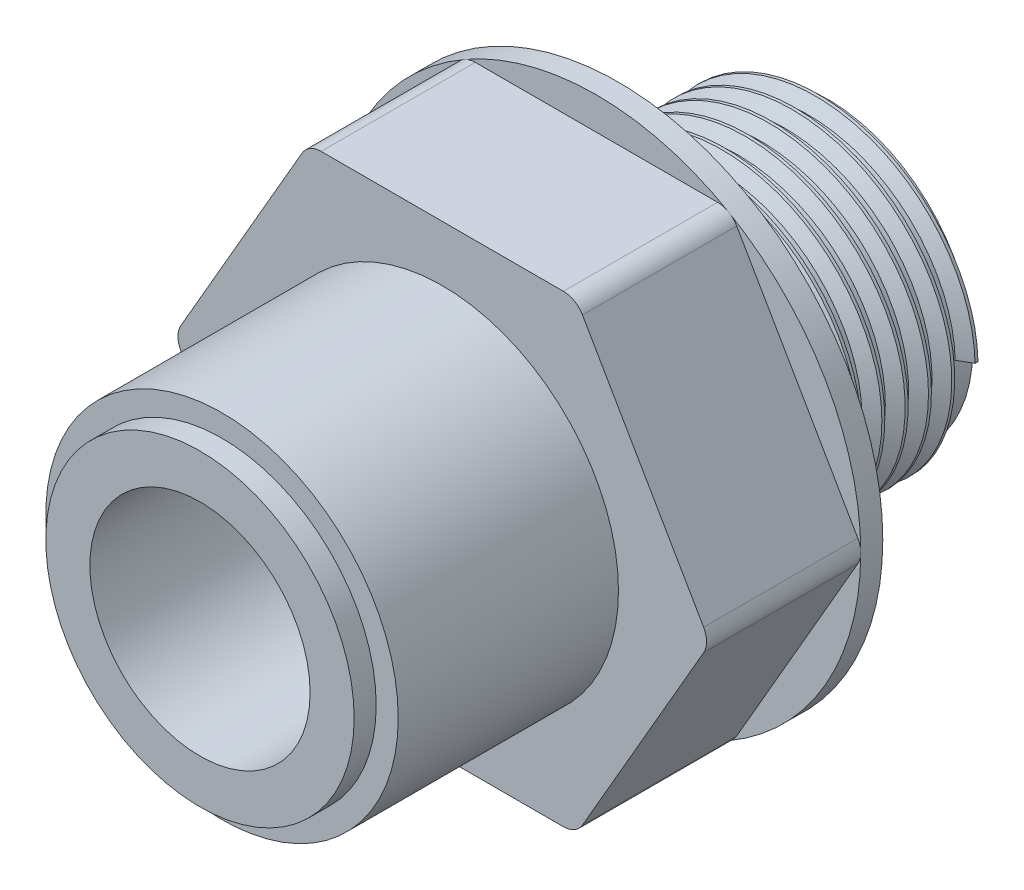
from build123d import *

# Parameters (mm, degrees)
THREAD1_PITCH      = 1.058333333
SKETCH6_OUTSIDE_W  = 34.864
SKETCH6_OUTSIDE_H  = 34.864
SKETCH6_OUTSIDE_R  = 7
CUT_EXTRUDE1_DEPTH = 1
SKETCH8_OUTSIDE_W  = 34.864
SKETCH8_OUTSIDE_H  = 34.864
CUT_EXTRUDE3_DEPTH = 7
SKETCH9_R          = 5
CUT_EXTRUDE4_DEPTH = 19


with BuildPart() as part:
    # Sketch2 → Revolve1 (revolve)
    with BuildSketch(Plane(origin=(0, 0, 0), x_dir=(0, 0, -1), z_dir=(1, 0, 0)), mode=Mode.PRIVATE) as revolve1_sk:
        Polygon((0, 3.75), (28.5, 3.75), (28.5, 6.58), (19, 6.58), (19, 12), (11, 12), (11, 8), (0, 8), align=None)
    revolve(revolve1_sk.sketch.rotate(Axis((0, 0, 17.665917422), (0, 0, -1)), 90), axis=Axis((0, 0, 17.665917422), (0, 0, -1)))

    # Thread1: the profile of Thread Profile1 profile screwed along a right-hand helix of 8.976378 turns, 8 arcs to a turn; built about Z, then put on its axis
    thread1_z = Axis((0, 0, 0), (0, 0, 1))
    thread1_corners = [(6.5797, 0, -0.000173205), (7.152839718, 0, 0.330729165), (7.152839718, 0, 0.463020832), (6.5797, 0, 0.793923202)]
    with BuildLine(mode=Mode.PRIVATE) as thread1_profile:
        Line(thread1_corners[0], thread1_corners[1])
        Line(thread1_corners[1], thread1_corners[2])
        Line(thread1_corners[2], thread1_corners[3])
        Line(thread1_corners[3], thread1_corners[0])
    thread1_cap = Face(thread1_profile.wire())
    thread1_turn_angles = [0, 22.5, 45, 67.5, 90, 112.5, 135, 157.5, 180, 202.5, 225, 247.5, 270, 292.5, 315, 337.5, 360]
    thread1_turn_weights = [1, 0.9238795325112867, 1, 0.9238795325112867, 1, 0.9238795325112867, 1, 0.9238795325112867, 1, 0.9238795325112867, 1, 0.9238795325112867, 1, 0.9238795325112867, 1, 0.9238795325112867, 1]
    thread1_turn_rails = [Edge.make_bspline([Vector(p[0], p[1], 0).rotate(thread1_z, thread1_turn_angles[k]) / thread1_turn_weights[k] + Vector(0, 0, p[2] + THREAD1_PITCH * thread1_turn_angles[k] / 360) for k in range(17)], [0, 0, 0, 1, 1, 2, 2, 3, 3, 4, 4, 5, 5, 6, 6, 7, 7, 8, 8, 8], 2, thread1_turn_weights) for p in thread1_corners]
    thread1_turn_sides = [Face.make_surface_from_curves(thread1_turn_rails[p[0]], thread1_turn_rails[p[1]]) for p in [(0, 1), (1, 2), (2, 3), (3, 0)]]
    thread1_last_angles = [2880, 2902.5, 2925, 2947.5, 2970, 2992.5, 3015, 3037.5, 3060, 3082.5, 3105, 3127.5, 3150, 3172.5, 3195, 3213.248031496, 3231.496062992]
    thread1_last_weights = [1, 0.9238795325112867, 1, 0.9238795325112867, 1, 0.9238795325112867, 1, 0.9238795325112867, 1, 0.9238795325112867, 1, 0.9238795325112867, 1, 0.9238795325112867, 1, 0.9497098849711307, 1]
    thread1_last_rails = [Edge.make_bspline([Vector(p[0], p[1], 0).rotate(thread1_z, thread1_last_angles[k]) / thread1_last_weights[k] + Vector(0, 0, p[2] + THREAD1_PITCH * thread1_last_angles[k] / 360) for k in range(17)], [0, 0, 0, 1, 1, 2, 2, 3, 3, 4, 4, 5, 5, 6, 6, 7, 7, 8, 8, 8], 2, thread1_last_weights) for p in thread1_corners]
    thread1_last_sides = [Face.make_surface_from_curves(thread1_last_rails[p[0]], thread1_last_rails[p[1]]) for p in [(0, 1), (1, 2), (2, 3), (3, 0)]]
    thread1 = Plane(origin=(0, 0, -28.5), x_dir=(1, 0, 0), z_dir=(0, 0, 1)) * Solid(Shell([*[p.moved(Location((0, 0, THREAD1_PITCH * i))) for i in range(8) for p in thread1_turn_sides], *thread1_last_sides, thread1_cap, thread1_cap.rotate(thread1_z, 3231.496062992).moved(Location((0, 0, THREAD1_PITCH * 3231.496062992 / 360)))]))
    add(thread1)

    # Sketch6 outside → Cut-Extrude1 (cut)
    with BuildSketch(Plane.XY):
        Rectangle(SKETCH6_OUTSIDE_W, SKETCH6_OUTSIDE_H)
        Circle(SKETCH6_OUTSIDE_R, mode=Mode.SUBTRACT)
    extrude(amount=-CUT_EXTRUDE1_DEPTH, mode=Mode.SUBTRACT)

    # Sketch8 outside → Cut-Extrude3 (cut)
    with BuildSketch(Plane.XY.offset(-11)):
        Rectangle(SKETCH8_OUTSIDE_W, SKETCH8_OUTSIDE_H)
        with BuildLine():
            Line((-5.5, 10.526279442), (5.5, 10.526279442))
            ThreePointArc((5.5, 10.526279442), (6, 10.392304845), (6.366025404, 10.026279442))
            Line((6.366025404, 10.026279442), (11.866025404, 0.5))
            ThreePointArc((11.866025404, 0.5), (12, 0), (11.866025404, -0.5))
            Line((11.866025404, -0.5), (6.366025404, -10.026279442))
            ThreePointArc((6.366025404, -10.026279442), (6, -10.392304845), (5.5, -10.526279442))
            Line((5.5, -10.526279442), (-5.5, -10.526279442))
            ThreePointArc((-5.5, -10.526279442), (-6, -10.392304845), (-6.366025404, -10.026279442))
            Line((-6.366025404, -10.026279442), (-11.866025404, -0.5))
            ThreePointArc((-11.866025404, -0.5), (-12, 0), (-11.866025404, 0.5))
            Line((-11.866025404, 0.5), (-6.366025404, 10.026279442))
            ThreePointArc((-6.366025404, 10.026279442), (-6, 10.392304845), (-5.5, 10.526279442))
        make_face(mode=Mode.SUBTRACT)
    extrude(amount=-CUT_EXTRUDE3_DEPTH, mode=Mode.SUBTRACT)

    # Sketch9 → Cut-Extrude4 (cut)
    with BuildSketch(Plane.XY):
        Circle(SKETCH9_R)
    extrude(amount=-CUT_EXTRUDE4_DEPTH, mode=Mode.SUBTRACT)


solid = part.part
